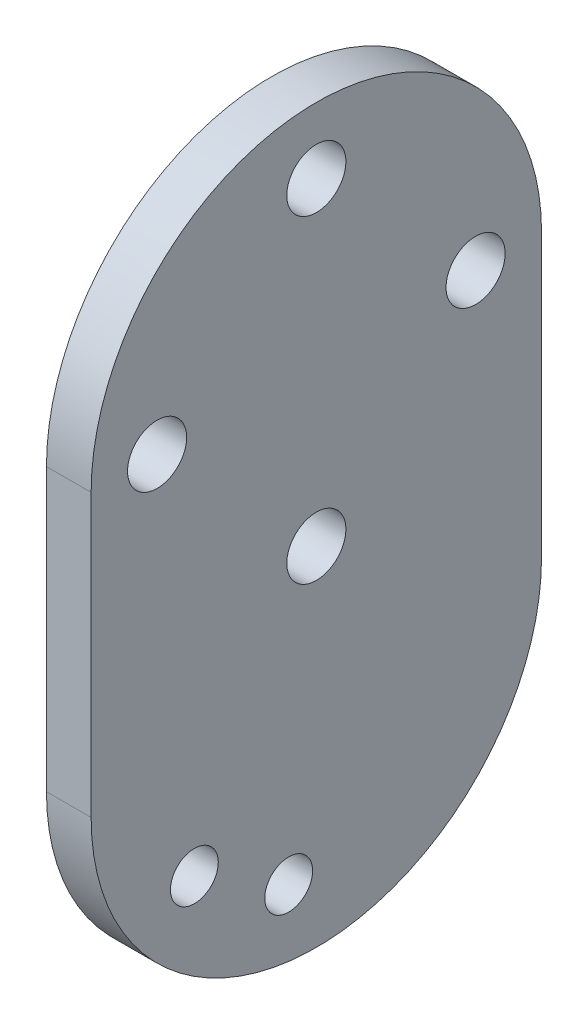
from build123d import *

# Parameters (mm, degrees)
SKETCH2_R           = 1.7
SKETCH2_R_2         = 2.1
BOSS_EXTRUDE1_DEPTH = 3.175


with BuildPart() as part:
    # Sketch2 → Boss-Extrude1 (new body)
    with BuildSketch(Plane(origin=(0, 0, 0), x_dir=(0, 0, -1), z_dir=(1, 0, 0))):
        with BuildLine():
            Line((25.4915032, 9.901325228), (25.4915032, -10.098674772))
            ThreePointArc((25.4915032, -10.098674772), (41.4915032, -26.098674772), (57.4915032, -10.098674772))
            Line((57.4915032, -10.098674772), (57.4915032, 9.901325228))
            ThreePointArc((57.4915032, 9.901325228), (41.4915032, 25.901325228), (25.4915032, 9.901325228))
        make_face()
        with Locations((39.526898337, -21.240502617)):
            Circle(SKETCH2_R, mode=Mode.SUBTRACT)
        with Locations((52.805211699, 9.901325228)):
            Circle(SKETCH2_R_2, mode=Mode.SUBTRACT)
        with Locations((41.4915032, 21.215033727)):
            Circle(SKETCH2_R_2, mode=Mode.SUBTRACT)
        with Locations((30.177794701, 9.901325228)):
            Circle(SKETCH2_R_2, mode=Mode.SUBTRACT)
        with Locations((32.824699674, -17.370986415)):
            Circle(SKETCH2_R, mode=Mode.SUBTRACT)
        with Locations((41.4915032, -1.412383271)):
            Circle(SKETCH2_R_2, mode=Mode.SUBTRACT)
    extrude(amount=BOSS_EXTRUDE1_DEPTH)


solid = part.part
